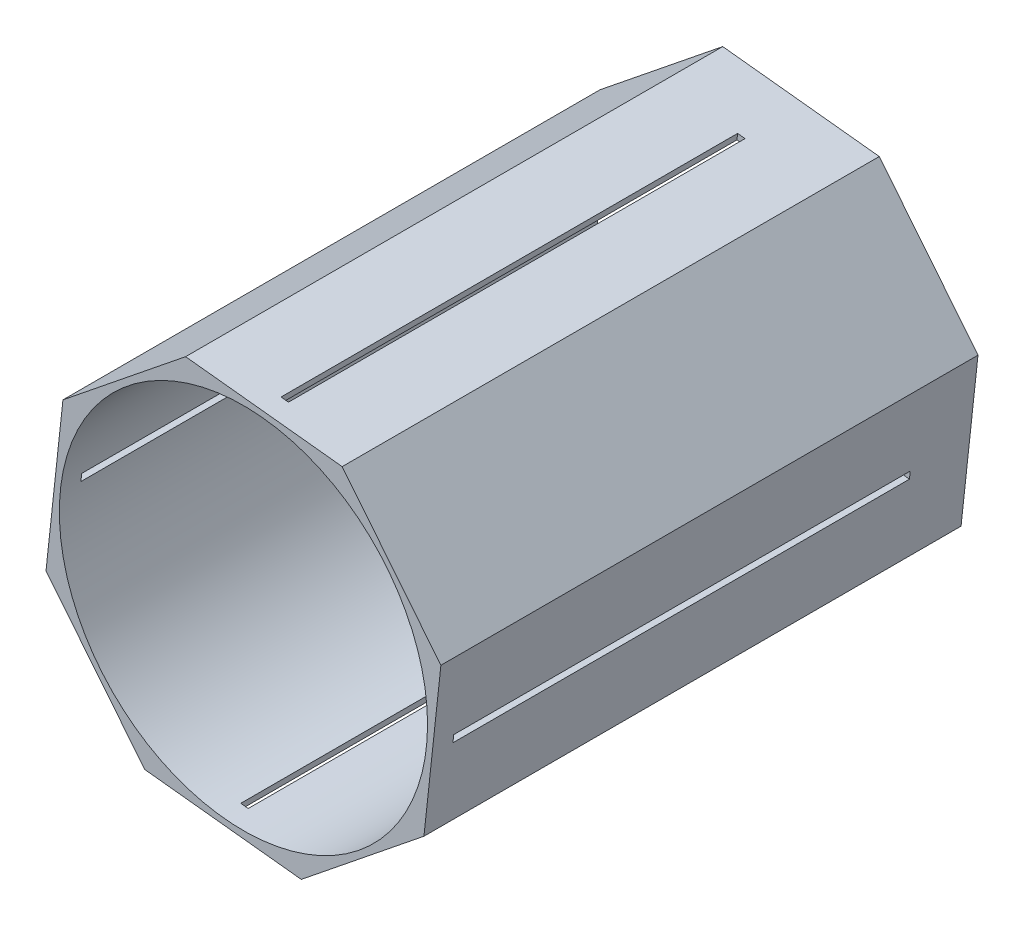
from build123d import *

# Parameters (mm, degrees)
SKETCH1_R           = 78.359
BOSS_EXTRUDE1_DEPTH = 228.6
SKETCH2_W           = 3.175
SKETCH2_H           = 194.31
CUT_EXTRUDE1_DEPTH  = 203.2
SKETCH5_W           = 194.31
SKETCH5_H           = 3.175
CUT_EXTRUDE2_DEPTH  = 203.2


with BuildPart() as part:
    # Sketch1 → Boss-Extrude1 (new body)
    with BuildSketch(Plane.XY):
        Polygon((76.82539232, -42.016561083), (84.033951141, 24.613560613), (42.016561083, 76.82539232), (-24.613560613, 84.033951141), (-76.82539232, 42.016561083), (-84.033951141, -24.613560613), (-42.016561083, -76.82539232), (24.613560613, -84.033951141), align=None)
        Circle(SKETCH1_R, mode=Mode.SUBTRACT)
    extrude(amount=BOSS_EXTRUDE1_DEPTH)

    # Sketch2 → Cut-Extrude1 (cut)
    with BuildSketch(Plane(origin=(8.701500235, 80.42967173, 0), x_dir=(0.9941985899756116, -0.10756004690639372, 0), z_dir=(0.10756004690639372, 0.9941985899756116, 0))):
        with Locations((0, -122.555)):
            Rectangle(SKETCH2_W, SKETCH2_H)
    extrude(amount=-CUT_EXTRUDE1_DEPTH, mode=Mode.SUBTRACT)

    # Sketch5 → Cut-Extrude2 (cut)
    with BuildSketch(Plane(origin=(-80.42967173, 8.701500235, 0), x_dir=(0, 0, 1), z_dir=(-0.9941985899756116, 0.10756004690639381, 0))):
        with Locations((122.555, 0)):
            Rectangle(SKETCH5_W, SKETCH5_H)
    extrude(amount=-CUT_EXTRUDE2_DEPTH, mode=Mode.SUBTRACT)


solid = part.part
